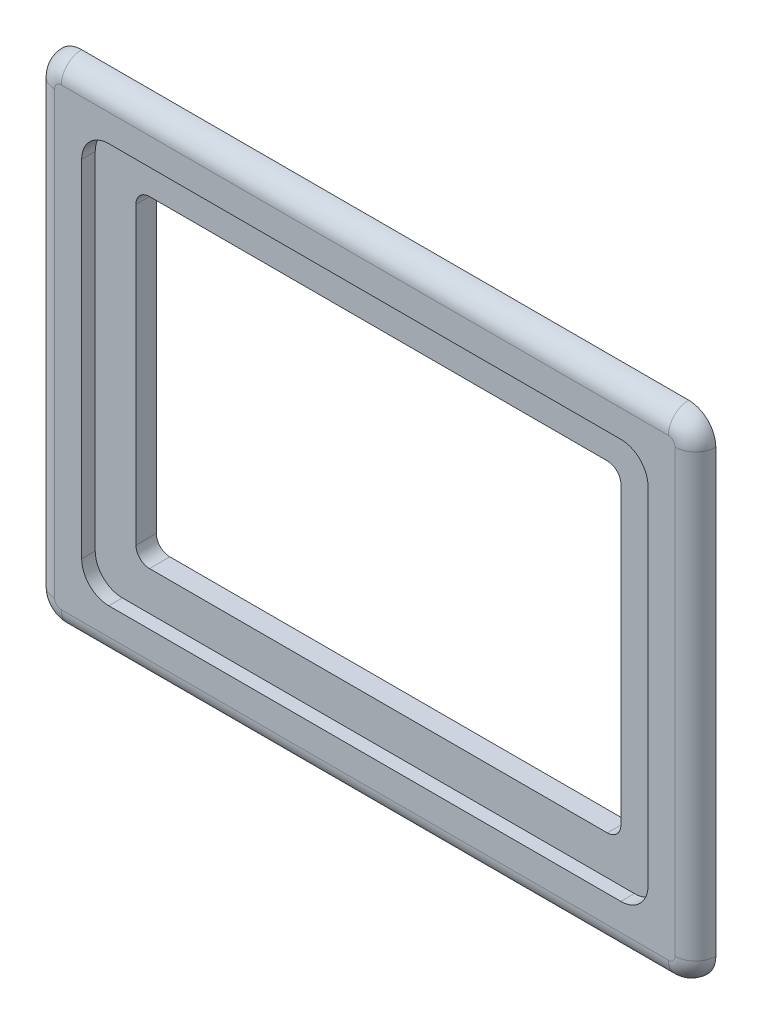
from build123d import *

# Parameters (mm, degrees)
SKETCH1_W           = 309.5625
SKETCH1_H           = 231.775
SKETCH1_W_2         = 265.1125
SKETCH1_H_2         = 187.325
SKETCH1_W_3         = 227.0125
SKETCH1_H_3         = 150.8125
BOSS_EXTRUDE1_DEPTH = 9.525
SKETCH1_3_W         = 265.1125
SKETCH1_3_H         = 187.325
SKETCH1_3_W_2       = 227.0125
SKETCH1_3_H_2       = 150.8125
BOSS_EXTRUDE2_DEPTH = 6.35
FILLET1_R           = 12.7
CUT_EXTRUDE1_START  = 9.525
SKETCH1_4_W         = 265.1125
SKETCH1_4_H         = 187.325
SKETCH1_4_W_2       = 227.0125
SKETCH1_4_H_2       = 150.8125
CUT_EXTRUDE1_DEPTH  = 6.35
FILLET2_R           = 6.35
FILLET3_R           = 12.7
FILLET4_R           = 9.525


with BuildPart() as part:
    # Sketch1 → Boss-Extrude1 (new body)
    # profile 1 of 2: a face of its own
    with BuildSketch(Plane.XY):
        Rectangle(SKETCH1_W, SKETCH1_H)
        Rectangle(SKETCH1_W_2, SKETCH1_H_2, mode=Mode.SUBTRACT)
    # profile 2 of 2: a face of its own
    with BuildSketch(Plane.XY):
        Rectangle(SKETCH1_W_2, SKETCH1_H_2)
        Rectangle(SKETCH1_W_3, SKETCH1_H_3, mode=Mode.SUBTRACT)
    extrude(amount=BOSS_EXTRUDE1_DEPTH)

    # Sketch1<3> → Boss-Extrude2 (add)
    with BuildSketch(Plane.XY):
        Rectangle(SKETCH1_3_W, SKETCH1_3_H)
        Rectangle(SKETCH1_3_W_2, SKETCH1_3_H_2, mode=Mode.SUBTRACT)
    extrude(amount=-BOSS_EXTRUDE2_DEPTH)

    # Fillet1
    fillet1_edges = [part.edges().sort_by_distance(p)[0] for p in [
        (-154.78125, -115.8875, 4.7625),
        (-154.78125, 115.8875, 4.7625),
        (154.78125, 115.8875, 4.7625),
        (154.78125, -115.8875, 4.7625),
        (132.55625, -93.6625, -3.175),
        (-132.55625, -93.6625, -3.175),
        (-132.55625, 93.6625, -3.175),
        (132.55625, 93.6625, -3.175),
    ]]
    fillet(fillet1_edges, radius=FILLET1_R)

    # Sketch1<4> → Cut-Extrude1 (cut)
    with BuildSketch(Plane.XY.offset(CUT_EXTRUDE1_START)):
        Rectangle(SKETCH1_4_W, SKETCH1_4_H)
        Rectangle(SKETCH1_4_W_2, SKETCH1_4_H_2, mode=Mode.SUBTRACT)
    extrude(amount=-CUT_EXTRUDE1_DEPTH, mode=Mode.SUBTRACT)

    # Fillet2
    fillet2_edges = [part.edges().sort_by_distance(p)[0] for p in [
        (-113.50625, 75.40625, -1.5875),
        (113.50625, 75.40625, -1.5875),
        (-113.50625, -75.40625, -1.5875),
        (113.50625, -75.40625, -1.5875),
    ]]
    fillet(fillet2_edges, radius=FILLET2_R)

    # Fillet3
    fillet3_edges = [part.edges().sort_by_distance(p)[0] for p in [
        (-132.55625, -93.6625, 6.35),
        (-132.55625, 93.6625, 6.35),
        (132.55625, 93.6625, 6.35),
        (132.55625, -93.6625, 6.35),
    ]]
    fillet(fillet3_edges, radius=FILLET3_R)

    # Fillet4
    fillet4_edges = [part.edges().sort_by_distance(p)[0] for p in [
        (-151.061506121, -112.167756121, 9.525),
        (0, -115.8875, 9.525),
        (151.061506121, -112.167756121, 9.525),
        (154.78125, 0, 9.525),
        (151.061506121, 112.167756121, 9.525),
        (0, 115.8875, 9.525),
        (-151.061506121, 112.167756121, 9.525),
        (-154.78125, 0, 9.525),
    ]]
    fillet(fillet4_edges, radius=FILLET4_R - 0.0001)  # a hair under: the kernel refuses the full size


solid = part.part
